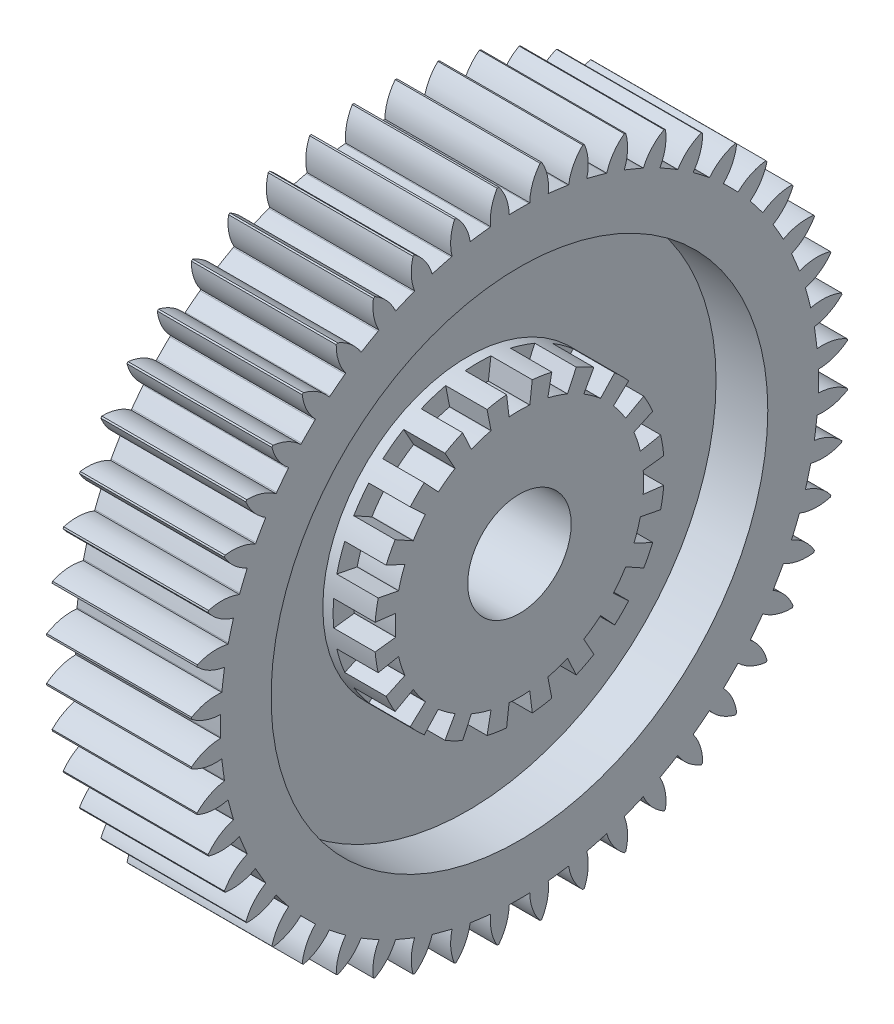
from build123d import *

# Parameters (mm, degrees)
SKETCH1_R                = 158.75
BOSS_EXTRUDE1_DEPTH      = 35
SKETCH2_R                = 25
CUT_EXTRUDE1_DEPTH       = 236.166164658
SKETCH3_R                = 120
SKETCH3_R_2              = 70
CUT_EXTRUDE2_DEPTH       = 25
CUT_EXTRUDE3_DEPTH       = 236.166164658
FILLET2_R                = 260
CIRPATTERN1_COUNT        = 48
FILLET2_OF_CIRPATTERN1_R = 260
CUT_EXTRUDE4_DEPTH       = 20
FILLET3_R                = 60
CIRPATTERN2_COUNT        = 20
FILLET3_OF_CIRPATTERN2_R = 60


with BuildPart() as part:
    # Sketch1 → Boss-Extrude1 (new, symmetric)
    with BuildSketch(Plane(origin=(0, 0, 0), x_dir=(0, 0, -1), z_dir=(1, 0, 0))):
        Circle(SKETCH1_R)
    extrude(amount=BOSS_EXTRUDE1_DEPTH, both=True)

    # Sketch2 → Cut-Extrude1 (cut, through all)
    with BuildSketch(Plane(origin=(35, 0, 0), x_dir=(0, 0, -1), z_dir=(1, 0, 0))):
        Circle(SKETCH2_R)
    extrude(amount=-CUT_EXTRUDE1_DEPTH, mode=Mode.SUBTRACT)

    # Sketch3 → Cut-Extrude2 (cut)
    with BuildSketch(Plane(origin=(35, 0, 0), x_dir=(0, 0, -1), z_dir=(1, 0, 0))):
        Circle(SKETCH3_R)
        Circle(SKETCH3_R_2, mode=Mode.SUBTRACT)
    extrude(amount=-CUT_EXTRUDE2_DEPTH, mode=Mode.SUBTRACT)

    # Sketch4 → Cut-Extrude3 (cut, through all)
    with BuildSketch(Plane(origin=(35, 0, 0), x_dir=(0, 0, -1), z_dir=(1, 0, 0))):
        with BuildLine():
            Line((0, 144.465), (-4.985, 144.378966612))
            ThreePointArc((-4.985, 144.378966612), (-6.331855437, 151.815196832), (-9.975, 158.436302264))
            Line((-9.975, 158.436302264), (0, 169.23563547))
            Line((0, 169.23563547), (9.975, 158.436302264))
            ThreePointArc((9.975, 158.436302264), (6.331855437, 151.815196832), (4.985, 144.378966612))
            Line((4.985, 144.378966612), (0, 144.465))
        make_face()
    cut_extrude3 = extrude(amount=-CUT_EXTRUDE3_DEPTH, mode=Mode.SUBTRACT)

    # Fillet2
    # the kernel refuses this fillet: 260 mm, written as the material it takes off along each edge
    with BuildSketch(Plane(origin=(46.2179944, 144.465, 0), x_dir=(0, -0.017255883246156536, 0.99985110616201), z_dir=(-1, 0, 0))) as fillet2_piece_1:
        with BuildLine():
            CenterArc((FILLET2_R * 0.0172584529235, -FILLET2_R), FILLET2_R, 90, 1.977476709)
            Line((-FILLET2_R * 0.0172481749795, -FILLET2_R * 0.00059553101321), (0, 0))
            Line((0, 0), (FILLET2_R * 0.0172584529235, 0))
        make_face()
    extrude(amount=92.4359888, mode=Mode.SUBTRACT)

    # CirPattern1: Cut-Extrude3 ×48 about axis
    cirpattern1_axis = Axis((0, 0, 0), (1, 0, 0))
    for i in range(1, CIRPATTERN1_COUNT):
        add(cut_extrude3.rotate(cirpattern1_axis, i * 360 / CIRPATTERN1_COUNT), mode=Mode.SUBTRACT)

    # Fillet2 of CirPattern1
    # the kernel refuses this fillet: 260 mm, written as the material it takes off along each edge
    with BuildSketch(Plane(origin=(46.2179944, 143.229081898, 18.856466359), x_dir=(0, -0.14761501444721029, 0.989044896609729), z_dir=(-1, 0, 0)), Plane(origin=(46.2179944, 139.542474495, 37.390293351), x_dir=(0, -0.27544841182444524, 0.9613158546614067), z_dir=(-1, 0, 0)), Plane(origin=(46.2179944, 133.468256664, 55.284362057), x_dir=(0, -0.3985688105066405, 0.9171384319127194), z_dir=(-1, 0, 0)), Plane(origin=(46.2179944, 125.110359958, 72.2325), x_dir=(0, -0.5148695863369176, 0.8572685163151924), z_dir=(-1, 0, 0)), Plane(origin=(46.2179944, 114.611790305, 87.944719842), x_dir=(0, -0.6223608007961524, 0.7827304987237765), z_dir=(-1, 0, 0)), Plane(origin=(46.2179944, 102.152181144, 102.152181144), x_dir=(0, -0.7192032494027522, 0.6947997452853036), z_dir=(-1, 0, 0)), Plane(origin=(46.2179944, 87.944719842, 114.611790305), x_dir=(0, -0.8037399310112562, 0.5949807755701197), z_dir=(-1, 0, 0)), Plane(origin=(46.2179944, 72.2325, 125.110359958), x_dir=(0, -0.8745243995613533, 0.48498151982509036), z_dir=(-1, 0, 0)), Plane(origin=(46.2179944, 55.284362057, 133.468256664), x_dir=(0, -0.9303455131709809, 0.36668409581358197), z_dir=(-1, 0, 0)), Plane(origin=(46.2179944, 37.390293351, 139.542474495), x_dir=(0, -0.9702481571097503, 0.242112605258655), z_dir=(-1, 0, 0)), Plane(origin=(46.2179944, 18.856466359, 143.229081898), x_dir=(0, -0.9935495860767596, 0.11339850090146575), z_dir=(-1, 0, 0)), Plane(origin=(46.2179944, 0, 144.465), x_dir=(0, -0.9998511061620098, -0.017255883246162864), z_dir=(-1, 0, 0)), Plane(origin=(46.2179944, -18.856466359, 143.229081898), x_dir=(0, -0.989044896609729, -0.14761501444721029), z_dir=(-1, 0, 0)), Plane(origin=(46.2179944, -37.390293351, 139.542474495), x_dir=(0, -0.9613158546614067, -0.27544841182444524), z_dir=(-1, 0, 0)), Plane(origin=(46.2179944, -55.284362057, 133.468256664), x_dir=(0, -0.917138431912719, -0.39856881050664106), z_dir=(-1, 0, 0)), Plane(origin=(46.2179944, -72.2325, 125.110359958), x_dir=(0, -0.857268516315191, -0.5148695863369199), z_dir=(-1, 0, 0)), Plane(origin=(46.2179944, -87.944719842, 114.611790305), x_dir=(0, -0.7827304987237765, -0.6223608007961524), z_dir=(-1, 0, 0)), Plane(origin=(46.2179944, -102.152181144, 102.152181144), x_dir=(0, -0.6947997452853036, -0.7192032494027522), z_dir=(-1, 0, 0)), Plane(origin=(46.2179944, -114.611790305, 87.944719842), x_dir=(0, -0.5949807755701183, -0.8037399310112572), z_dir=(-1, 0, 0)), Plane(origin=(46.2179944, -125.110359958, 72.2325), x_dir=(0, -0.4849815198250917, -0.8745243995613525), z_dir=(-1, 0, 0)), Plane(origin=(46.2179944, -133.468256664, 55.284362057), x_dir=(0, -0.3666840958135765, -0.9303455131709831), z_dir=(-1, 0, 0)), Plane(origin=(46.2179944, -139.542474495, 37.390293351), x_dir=(0, -0.24211260525865538, -0.9702481571097503), z_dir=(-1, 0, 0)), Plane(origin=(46.2179944, -143.229081898, 18.856466359), x_dir=(0, -0.11339850090145955, -0.9935495860767604), z_dir=(-1, 0, 0)), Plane(origin=(46.2179944, -144.465, 0), x_dir=(0, 0.017255883246156532, -0.99985110616201), z_dir=(-1, 0, 0)), Plane(origin=(46.2179944, -143.229081898, -18.856466359), x_dir=(0, 0.14761501444720423, -0.98904489660973), z_dir=(-1, 0, 0)), Plane(origin=(46.2179944, -139.542474495, -37.390293351), x_dir=(0, 0.2754484118244457, -0.9613158546614066), z_dir=(-1, 0, 0)), Plane(origin=(46.2179944, -133.468256664, -55.284362057), x_dir=(0, 0.39856881050664167, -0.9171384319127189), z_dir=(-1, 0, 0)), Plane(origin=(46.2179944, -125.110359958, -72.2325), x_dir=(0, 0.514869586336919, -0.8572685163151916), z_dir=(-1, 0, 0)), Plane(origin=(46.2179944, -114.611790305, -87.944719842), x_dir=(0, 0.6223608007961509, -0.7827304987237778), z_dir=(-1, 0, 0)), Plane(origin=(46.2179944, -102.152181144, -102.152181144), x_dir=(0, 0.7192032494027505, -0.6947997452853051), z_dir=(-1, 0, 0)), Plane(origin=(46.2179944, -87.944719842, -114.611790305), x_dir=(0, 0.8037399310112572, -0.5949807755701183), z_dir=(-1, 0, 0)), Plane(origin=(46.2179944, -72.2325, -125.110359958), x_dir=(0, 0.8745243995613525, -0.4849815198250917), z_dir=(-1, 0, 0)), Plane(origin=(46.2179944, -55.284362057, -133.468256664), x_dir=(0, 0.9303455131709811, -0.36668409581358147), z_dir=(-1, 0, 0)), Plane(origin=(46.2179944, -37.390293351, -139.542474495), x_dir=(0, 0.9702481571097503, -0.24211260525865538), z_dir=(-1, 0, 0)), Plane(origin=(46.2179944, -18.856466359, -143.229081898), x_dir=(0, 0.9935495860767596, -0.11339850090146565), z_dir=(-1, 0, 0)), Plane(origin=(46.2179944, 0, -144.465), x_dir=(0, 0.9998511061620098, 0.017255883246162868), z_dir=(-1, 0, 0)), Plane(origin=(46.2179944, 18.856466359, -143.229081898), x_dir=(0, 0.9890448966097283, 0.14761501444721675), z_dir=(-1, 0, 0)), Plane(origin=(46.2179944, 37.390293351, -139.542474495), x_dir=(0, 0.9613158546614067, 0.2754484118244448), z_dir=(-1, 0, 0)), Plane(origin=(46.2179944, 55.284362057, -133.468256664), x_dir=(0, 0.9171384319127189, 0.39856881050664167), z_dir=(-1, 0, 0)), Plane(origin=(46.2179944, 72.2325, -125.110359958), x_dir=(0, 0.8572685163151916, 0.514869586336919), z_dir=(-1, 0, 0)), Plane(origin=(46.2179944, 87.944719842, -114.611790305), x_dir=(0, 0.7827304987237765, 0.6223608007961524), z_dir=(-1, 0, 0)), Plane(origin=(46.2179944, 102.152181144, -102.152181144), x_dir=(0, 0.6947997452853036, 0.719203249402752), z_dir=(-1, 0, 0)), Plane(origin=(46.2179944, 114.611790305, -87.944719842), x_dir=(0, 0.5949807755701183, 0.8037399310112572), z_dir=(-1, 0, 0)), Plane(origin=(46.2179944, 125.110359958, -72.2325), x_dir=(0, 0.4849815198250917, 0.8745243995613525), z_dir=(-1, 0, 0)), Plane(origin=(46.2179944, 133.468256664, -55.284362057), x_dir=(0, 0.3666840958135765, 0.9303455131709831), z_dir=(-1, 0, 0)), Plane(origin=(46.2179944, 139.542474495, -37.390293351), x_dir=(0, 0.24211260525865538, 0.9702481571097503), z_dir=(-1, 0, 0)), Plane(origin=(46.2179944, 143.229081898, -18.856466359), x_dir=(0, 0.11339850090146575, 0.9935495860767596), z_dir=(-1, 0, 0))) as fillet2_of_cirpattern1_piece_1:
        with BuildLine():
            CenterArc((FILLET2_OF_CIRPATTERN1_R * 0.0172584529235, -FILLET2_OF_CIRPATTERN1_R), FILLET2_OF_CIRPATTERN1_R, 90, 1.977476709)
            Line((-FILLET2_OF_CIRPATTERN1_R * 0.0172481749795, -FILLET2_OF_CIRPATTERN1_R * 0.00059553101321), (0, 0))
            Line((0, 0), (FILLET2_OF_CIRPATTERN1_R * 0.0172584529235, 0))
        make_face()
    extrude(amount=92.4359888, mode=Mode.SUBTRACT)

    # Sketch6 → Cut-Extrude4 (cut)
    with BuildSketch(Plane(origin=(35, 0, 0), x_dir=(0, 0, -1), z_dir=(1, 0, 0))):
        Polygon((-5, 59.791303716), (-10.343917439, 103.730429129), (10.343917439, 103.730429129), (5, 59.791303716), (0, 60.194220807), align=None)
    cut_extrude4 = extrude(amount=-CUT_EXTRUDE4_DEPTH, mode=Mode.SUBTRACT)

    # Fillet3
    fillet3_edges = [part.edges().sort_by_distance(p)[0] for p in [
        (25, 60.194220807, 0),
    ]]
    fillet(fillet3_edges, radius=FILLET3_R)

    # CirPattern2: Cut-Extrude4 ×20 about axis
    cirpattern2_axis = Axis((0, 0, 0), (1, 0, 0))
    for i in range(1, CIRPATTERN2_COUNT):
        add(cut_extrude4.rotate(cirpattern2_axis, i * 360 / CIRPATTERN2_COUNT), mode=Mode.SUBTRACT)

    # Fillet3 of CirPattern2
    fillet3_of_cirpattern2_edges = [part.edges().sort_by_distance(p)[0] for p in [
        (25, 57.248105942, 18.601037192),
        (25, 48.698147596, 35.381275263),
        (25, 35.381275263, 48.698147596),
        (25, 18.601037192, 57.248105942),
        (25, 0, 60.194220807),
        (25, -18.601037192, 57.248105942),
        (25, -35.381275263, 48.698147596),
        (25, -48.698147596, 35.381275263),
        (25, -57.248105942, 18.601037192),
        (25, -60.194220807, 0),
        (25, -57.248105942, -18.601037192),
        (25, -48.698147596, -35.381275263),
        (25, -35.381275263, -48.698147596),
        (25, -18.601037192, -57.248105942),
        (25, 0, -60.194220807),
        (25, 18.601037192, -57.248105942),
        (25, 35.381275263, -48.698147596),
        (25, 48.698147596, -35.381275263),
        (25, 57.248105942, -18.601037192),
    ]]
    fillet(fillet3_of_cirpattern2_edges, radius=FILLET3_OF_CIRPATTERN2_R)


solid = part.part
